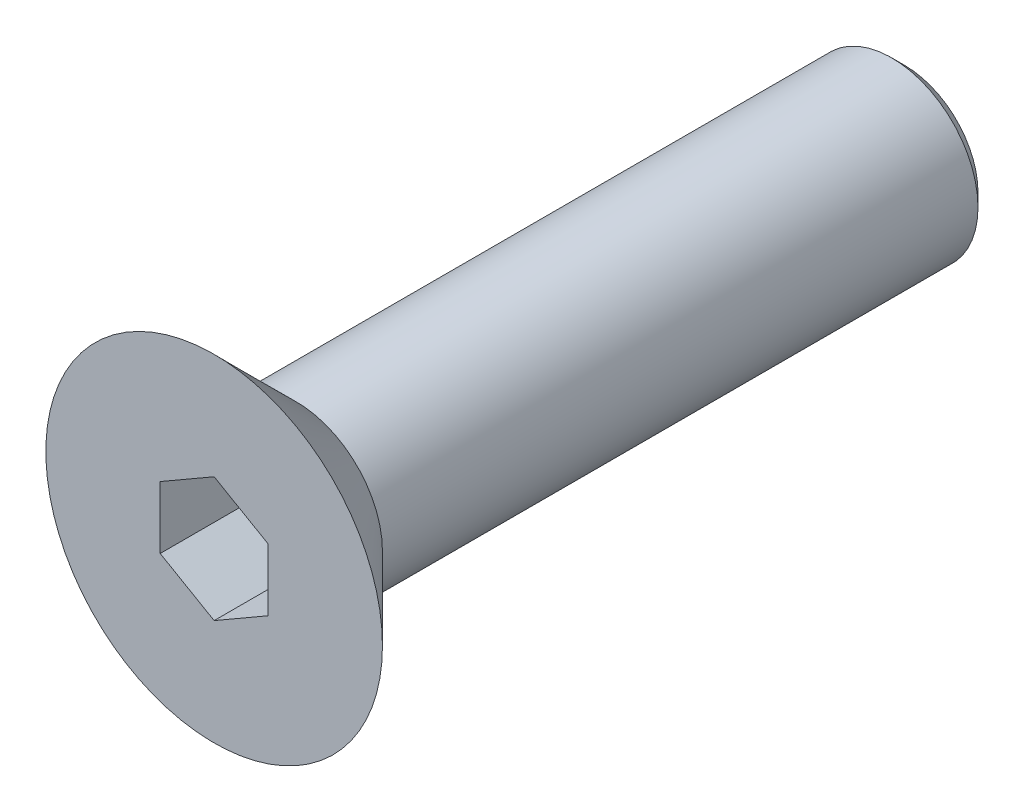
from build123d import *

# Parameters (mm, degrees)
SKETCH1_R           = 4
BOSS_EXTRUDE1_DEPTH = 2.3
SKETCH2_R           = 2
BOSS_EXTRUDE2_DEPTH = 13.7
CHAMFER1_SIZE       = 0.3
CUT_EXTRUDE1_DEPTH  = 2
CHAMFER2_SIZE       = 2.4


with BuildPart() as part:
    # Sketch1 → Boss-Extrude1 (new body)
    with BuildSketch(Plane.XY):
        Circle(SKETCH1_R)
    extrude(amount=BOSS_EXTRUDE1_DEPTH)

    # Sketch2 → Boss-Extrude2 (add)
    with BuildSketch(Plane(origin=(0, 0, 0), x_dir=(-1, 0, 0), z_dir=(0, 0, -1))):
        with Locations(Location((0, 0, 0), (0, 0, 180))):
            Circle(SKETCH2_R)
    extrude(amount=BOSS_EXTRUDE2_DEPTH)

    # Chamfer1
    chamfer1_edges = [part.edges().sort_by_distance(p)[0] for p in [
        (-2, 0, -13.7),
    ]]
    chamfer(chamfer1_edges, length=CHAMFER1_SIZE)

    # Sketch3 → Cut-Extrude1 (cut)
    with BuildSketch(Plane.XY.offset(2.3)):
        Polygon((0, 1.443375673), (-1.25, 0.721687836), (-1.25, -0.721687836), (0, -1.443375673), (1.25, -0.721687836), (1.25, 0.721687836), align=None)
    extrude(amount=-CUT_EXTRUDE1_DEPTH, mode=Mode.SUBTRACT)

    # Chamfer2
    # the kernel refuses this chamfer: 2.4 mm, written as the material it takes off along each edge
    with BuildSketch(Plane(origin=(0, 0, 0), x_dir=(1, 0, 0), z_dir=(0, -1, 0))) as chamfer2_piece_1_section:
        Polygon((4 - CHAMFER2_SIZE, 0), (4, CHAMFER2_SIZE), (4, 0), align=None)
    chamfer2_piece_1 = revolve(axis=Axis((0, 0, 0), (0, 0, 1)), mode=Mode.PRIVATE)
    chamfer2_piece_1 = chamfer2_piece_1 - Plane(origin=(0, 0, 1.405884102), x_dir=(1, 0, 0), z_dir=(0, 0, 1)) * Cylinder(2, 16, mode=Mode.PRIVATE)
    add(chamfer2_piece_1, mode=Mode.SUBTRACT)


solid = part.part
